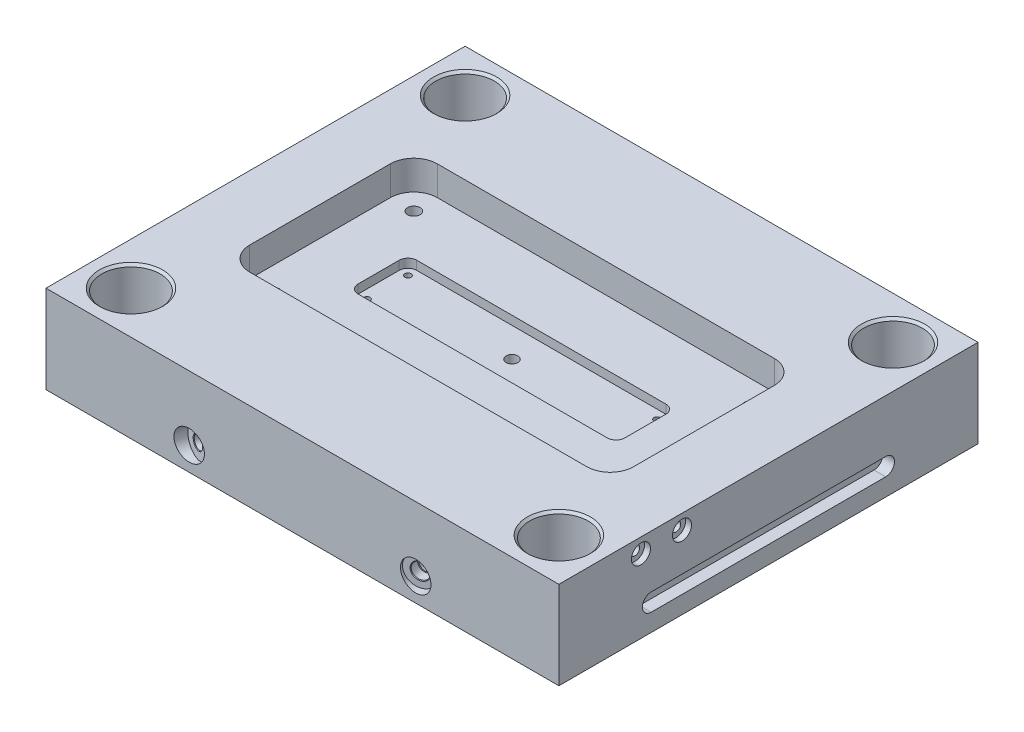
from build123d import *

# Parameters (mm, degrees)
SKETCH1_W                                        = 555.625
SKETCH1_H                                        = 454.025
BOSS_EXTRUDE1_DEPTH                              = 95.25
CUT_EXTRUDE2_DEPTH                               = 31.75
F_1_2_THX_EJECTOR_PIN_CLEARANCE_HOLE1_D          = 12.7
SKETCH20_W                                       = 288.925
SKETCH20_H                                       = 63.5
CUT_EXTRUDE5_DEPTH                               = 9.525
FILLET4_R                                        = 9.525
CUT_EXTRUDE6_DEPTH                               = 12.7
CBORE_START                                      = -279
CBORE_FOR_3_8_BINDING_HEAD_MACHINE_S_2_R         = 5.0419
CBORE_FOR_3_8_BINDING_HEAD_MACHINE_SCREW_DEPTH   = 556.8125
CBORE_START_2                                    = 182.5625
CBORE_FOR_3_8_BINDING_HEAD_MACHINE_S_3_O_R       = 5.0419
CBORE_FOR_3_8_BINDING_HEAD_MACHINE_S_3_DEPTH     = 95.25
CBORE_START_3                                    = 271.3863
CBORE_FOR_3_8_BINDING_HEAD_MACHINE_S_4_O_R       = 10.31875
CBORE_FOR_3_8_BINDING_HEAD_MACHINE_S_4_O_R_2     = 5.0419
CBORE_FOR_3_8_BINDING_HEAD_MACHINE_S_4_DEPTH     = 6.4262
CBORE_FOR_1_4_SOCKET_HEAD_CAP_SCREW1_D           = 6.7564
CBORE_FOR_1_4_SOCKET_HEAD_CAP_SCREW1_CBORE_D     = 11.1125
CBORE_FOR_1_4_SOCKET_HEAD_CAP_SCREW1_CBORE_DEPTH = 6.35
F_3_8_NPT_TAPPED_HOLE1_AT_2_COUNT                = 2
F_3_8_NPT_TAPPED_HOLE1_AT_2_PITCH                = 127
CUT_EXTRUDE7_DEPTH                               = 610.452825098
CUT_EXTRUDE7_DEPTH_BACK                          = 7.62
SKETCH29_R                                       = 15.875
CUT_EXTRUDE8_DEPTH                               = 610.452825098
CUT_EXTRUDE8_DEPTH_BACK                          = 7.62
SKETCH33_R                                       = 15.875
CBORE_FOR_1_2_SOCKET_HEAD_CAP_SCREW1_D           = 13.49248
CBORE_FOR_1_2_SOCKET_HEAD_CAP_SCREW1_CBORE_D     = 20.6375
CBORE_FOR_1_2_SOCKET_HEAD_CAP_SCREW1_CBORE_DEPTH = 12.7
F_1_1_DIAMETER_HOLE1_D                           = 63.5
CHAMFER1_SIZE                                    = 2.54


with BuildPart() as part:
    # Sketch1 → Boss-Extrude1 (new body)
    with BuildSketch(Plane(origin=(0, 0, 0), x_dir=(1, 0, 0), z_dir=(0, 1, 0))):
        Rectangle(SKETCH1_W, SKETCH1_H)
    extrude(amount=BOSS_EXTRUDE1_DEPTH)

    # Sketch6 → Cut-Extrude2 (cut)
    with BuildSketch(Plane(origin=(0, 95.25, 0), x_dir=(1, 0, 0), z_dir=(0, 1, 0))):
        with BuildLine():
            Line((-182.5625, 101.6), (182.5625, 101.6))
            ThreePointArc((182.5625, 101.6), (200.523012242, 94.160512242), (207.9625, 76.2))
            Line((207.9625, 76.2), (207.9625, -76.2))
            ThreePointArc((207.9625, -76.2), (200.523012242, -94.160512242), (182.5625, -101.6))
            Line((182.5625, -101.6), (-182.5625, -101.6))
            ThreePointArc((-182.5625, -101.6), (-200.523012242, -94.160512242), (-207.9625, -76.2))
            Line((-207.9625, -76.2), (-207.9625, 76.2))
            ThreePointArc((-207.9625, 76.2), (-200.523012242, 94.160512242), (-182.5625, 101.6))
        make_face()
    extrude(amount=-CUT_EXTRUDE2_DEPTH, mode=Mode.SUBTRACT)

    # 1/2 THX Ejector Pin Clearance Hole1 (through all)
    with Locations(Plane(origin=(0, 63.5, 0), x_dir=(1, 0, 0), z_dir=(0, 1, 0))):
        with Locations((0, 0)):
            Hole(F_1_2_THX_EJECTOR_PIN_CLEARANCE_HOLE1_D / 2)

    # Sketch20 → Cut-Extrude5 (cut)
    with BuildSketch(Plane(origin=(0, 63.5, 0), x_dir=(1, 0, 0), z_dir=(0, 1, 0))):
        Rectangle(SKETCH20_W, SKETCH20_H)
    extrude(amount=-CUT_EXTRUDE5_DEPTH, mode=Mode.SUBTRACT)

    # Fillet4
    fillet4_edges = [part.edges().sort_by_distance(p)[0] for p in [
        (-144.4625, 58.7375, 31.75),
        (-144.4625, 58.7375, -31.75),
        (144.4625, 58.7375, -31.75),
        (144.4625, 58.7375, 31.75),
    ]]
    fillet(fillet4_edges, radius=FILLET4_R)

    # Sketch21 → Cut-Extrude6 (cut)
    with BuildSketch(Plane(origin=(277.8125, 0, 0), x_dir=(0, 0, -1), z_dir=(1, 0, 0))):
        with BuildLine():
            Line((-127, 38.1), (127, 38.1))
            ThreePointArc((127, 38.1), (136.525, 28.575), (127, 19.05))
            Line((127, 19.05), (-127, 19.05))
            ThreePointArc((-127, 19.05), (-136.525, 28.575), (-127, 38.1))
        make_face()
    cut_extrude6 = extrude(amount=-CUT_EXTRUDE6_DEPTH, mode=Mode.SUBTRACT)

    # Mirror1: Cut-Extrude6 across plane
    add(cut_extrude6.mirror(Plane(origin=(0, 0, 0), x_dir=(0, 0, 1), z_dir=(1, 0, 0))), mode=Mode.SUBTRACT)

    # CBORE for 3/8 Binding Head Machine Screw1: read off the stored shape, not the designer's step
    # CBORE for 3_8 Binding Head Machine S 2 → CBORE for 3/8 Binding Head Machine Screw1 (cut)
    with BuildSketch(Plane.YZ.offset(CBORE_START)):
        with Locations((79.375, 138.1125)):
            Circle(CBORE_FOR_3_8_BINDING_HEAD_MACHINE_S_2_R)
    cbore_for_3_8_binding_head_machine_screw = extrude(amount=CBORE_FOR_3_8_BINDING_HEAD_MACHINE_SCREW_DEPTH, mode=Mode.SUBTRACT)

    # CBORE for 3_8 Binding Head Machine S 3 o → CBORE for 3_8 Binding Head Machine S 3 (cut)
    with BuildSketch(Plane.YZ.offset(CBORE_START_2)):
        with Locations((79.375, 93.6625)):
            Circle(CBORE_FOR_3_8_BINDING_HEAD_MACHINE_S_3_O_R)
    cbore_for_3_8_binding_head_machine_s_3 = extrude(amount=CBORE_FOR_3_8_BINDING_HEAD_MACHINE_S_3_DEPTH, mode=Mode.SUBTRACT)

    # CBORE for 3_8 Binding Head Machine S 4 o → CBORE for 3_8 Binding Head Machine S 4 (cut)
    # profile 1 of 2: a face of its own
    with BuildSketch(Plane.YZ.offset(CBORE_START_3)):
        with Locations((79.375, 93.6625)):
            Circle(CBORE_FOR_3_8_BINDING_HEAD_MACHINE_S_4_O_R)
        with Locations((79.375, 93.6625)):
            Circle(CBORE_FOR_3_8_BINDING_HEAD_MACHINE_S_4_O_R_2, mode=Mode.SUBTRACT)
    # profile 2 of 2: a face of its own
    with BuildSketch(Plane.YZ.offset(CBORE_START_3)):
        with Locations((79.375, 138.1125)):
            Circle(CBORE_FOR_3_8_BINDING_HEAD_MACHINE_S_4_O_R)
        with Locations((79.375, 138.1125)):
            Circle(CBORE_FOR_3_8_BINDING_HEAD_MACHINE_S_4_O_R_2, mode=Mode.SUBTRACT)
    cbore_for_3_8_binding_head_machine_s_4 = extrude(amount=CBORE_FOR_3_8_BINDING_HEAD_MACHINE_S_4_DEPTH, mode=Mode.SUBTRACT)

    # Mirror2: CBORE for 3/8 Binding Head Machine Screw1, CBORE for 3_8 Binding Head Machine S 3, CBORE for 3_8 Binding Head Machine S 4 across plane
    add(cbore_for_3_8_binding_head_machine_screw.mirror(Plane(origin=(0, 0, 0), x_dir=(0, 0, 1), z_dir=(1, 0, 0))), mode=Mode.SUBTRACT)
    add(cbore_for_3_8_binding_head_machine_s_3.mirror(Plane(origin=(0, 0, 0), x_dir=(0, 0, 1), z_dir=(1, 0, 0))), mode=Mode.SUBTRACT)
    add(cbore_for_3_8_binding_head_machine_s_4.mirror(Plane(origin=(0, 0, 0), x_dir=(0, 0, 1), z_dir=(1, 0, 0))), mode=Mode.SUBTRACT)

    # CBORE for 1/4 Socket Head Cap Screw1 (through all)
    with Locations(Plane(origin=(0, 0, 0), x_dir=(-1, 0, 0), z_dir=(0, -1, 0))):
        with Locations((134.9375, -22.225), (-134.9375, -22.225), (-134.9375, 22.225), (134.9375, 22.225)):
            CounterBoreHole(CBORE_FOR_1_4_SOCKET_HEAD_CAP_SCREW1_D / 2, CBORE_FOR_1_4_SOCKET_HEAD_CAP_SCREW1_CBORE_D / 2, CBORE_FOR_1_4_SOCKET_HEAD_CAP_SCREW1_CBORE_DEPTH)

    # Sketch26 → 3/8 NPT Tapped Hole1 (revolve, cut)
    with BuildSketch(Plane(origin=(63.5, 25.4, -227.0125), x_dir=(0, 1, 0), z_dir=(1, 0, 0))):
        Polygon((0, 0), (0, 258.288582582), (7.1374, 254), (7.1374, 10.3378), (8.282213774, 10.3378), (8.5727286, 0.635), (9.2077286, 0), align=None)
    f_3_8_npt_tapped_hole1 = revolve(axis=Axis((63.5, 25.4, -233.3625), (0, 0, 1)), mode=Mode.SUBTRACT)

    # 3/8 NPT Tapped Hole1 at 2: 3/8 NPT Tapped Hole1 ×2
    with Locations(*[(-i * F_3_8_NPT_TAPPED_HOLE1_AT_2_PITCH, 0, 0) for i in range(1, F_3_8_NPT_TAPPED_HOLE1_AT_2_COUNT)]):
        add(f_3_8_npt_tapped_hole1, mode=Mode.SUBTRACT)

    # Sketch29 → Cut-Extrude7 (cut, two sides: drawn at the far end of the back side and taken through both)
    with BuildSketch(Plane(origin=(122.705942623, 25.4, 227.0125), x_dir=(0.9612260674766229, 0, -0.275761576735097), z_dir=(0.275761576735097, 0, 0.9612260674766229)).offset(-CUT_EXTRUDE7_DEPTH_BACK)):
        with Locations(Location((0, 0, 0), (0, 0, 180))):
            Circle(SKETCH29_R)
    extrude(amount=CUT_EXTRUDE7_DEPTH + CUT_EXTRUDE7_DEPTH_BACK, mode=Mode.SUBTRACT)

    # 3/8 NPT Tapped Hole2: read off the stored shape, not the designer's step
    # 3/8 NPT Tapped Hole2 outline → 3/8 NPT Tapped Hole2 (revolve, cut)
    with BuildSketch(Plane(origin=(53.200811658, 25.4, -15.262527935), x_dir=(0.9612260674766229, 0, -0.275761576735097), z_dir=(0, -1, 0))):
        Polygon((0, 244.427916856), (0, 41.482490953), (7.1374, 41.482490953), (7.1374, 234.090116856), (8.282213774, 234.090116856), (8.5727286, 243.792916856), (9.2077286, 244.427916856), align=None)
    revolve(axis=Axis((53.200811658, 25.4, -15.262527935), (0.275761576735097, 0, 0.9612260674766229)), mode=Mode.SUBTRACT)

    # Sketch33 → Cut-Extrude8 (cut, two sides: drawn at the far end of the back side and taken through both)
    with BuildSketch(Plane(origin=(-122.705942623, 25.4, 227.0125), x_dir=(0.961226067476623, 0, 0.27576157673509694), z_dir=(-0.27576157673509694, 0, 0.961226067476623)).offset(-CUT_EXTRUDE8_DEPTH_BACK)):
        Circle(SKETCH33_R)
    extrude(amount=CUT_EXTRUDE8_DEPTH + CUT_EXTRUDE8_DEPTH_BACK, mode=Mode.SUBTRACT)

    # 1/4 NPT Tapped Hole3: read off the stored shape, not the designer's step
    # 1/4 NPT Tapped Hole3 outline → 1/4 NPT Tapped Hole3 (revolve, cut)
    with BuildSketch(Plane(origin=(-53.200811658, 25.4, -15.262527935), x_dir=(0.9612260674766229, 0, 0.275761576735097), z_dir=(0, 1, 0))):
        Polygon((5.5626, -234.394916856), (5.5626, -43.841031967), (0, -43.841031967), (0, -244.427916856), (7.4676, -244.427916856), (6.858381, -243.818697856), (6.576220377, -234.394916856), align=None)
    revolve(axis=Axis((-53.200811658, 25.4, -15.262527935), (0.275761576735097, 0, -0.9612260674766229)), mode=Mode.SUBTRACT)

    # CBORE for 1/2 Socket Head Cap Screw1 (through all)
    with Locations(Plane(origin=(0, 0, 0), x_dir=(-1, 0, 0), z_dir=(0, -1, 0))):
        with Locations((182.5625, -76.2), (182.5625, 76.2), (-182.5625, 76.2), (-182.5625, -76.2)):
            CounterBoreHole(CBORE_FOR_1_2_SOCKET_HEAD_CAP_SCREW1_D / 2, CBORE_FOR_1_2_SOCKET_HEAD_CAP_SCREW1_CBORE_D / 2, CBORE_FOR_1_2_SOCKET_HEAD_CAP_SCREW1_CBORE_DEPTH)

    # 1 (1) Diameter Hole1 (through all)
    with Locations(Plane(origin=(0, 95.25, 0), x_dir=(1, 0, 0), z_dir=(0, 1, 0))):
        with Locations((231.775, 180.975), (-231.775, 180.975), (-231.775, -180.975), (231.775, -180.975)):
            Hole(F_1_1_DIAMETER_HOLE1_D / 2)

    # Chamfer1
    chamfer1_edges = [part.edges().sort_by_distance(p)[0] for p in [
        (263.525, 95.25, 180.975),
        (-200.025, 95.25, 180.975),
        (-200.025, 95.25, -180.975),
        (263.525, 95.25, -180.975),
    ]]
    chamfer(chamfer1_edges, length=CHAMFER1_SIZE)


solid = part.part
